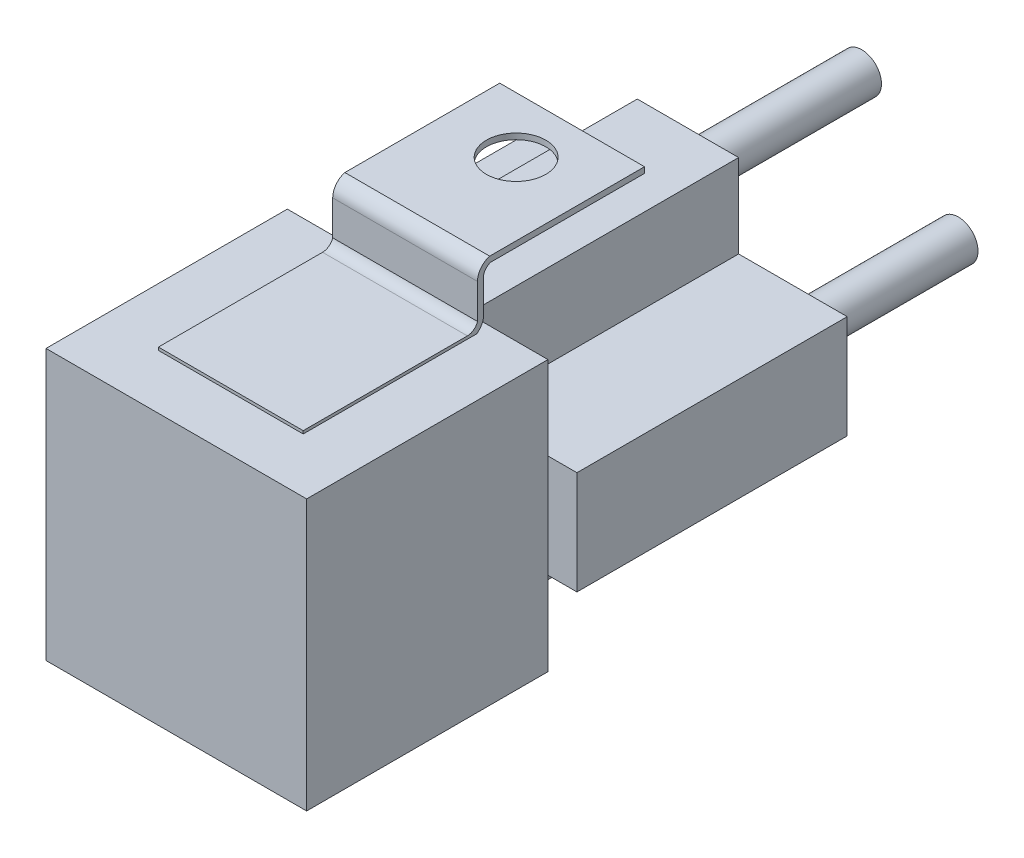
from build123d import *

# Parameters (mm, degrees)
SKETCH1_W           = 27
SKETCH1_H           = 28
BOSS_EXTRUDE1_DEPTH = 25
SKETCH2_W           = 33
SKETCH2_H           = 10.7
SKETCH2_W_2         = 10.5
SKETCH2_H_2         = 28
BOSS_EXTRUDE2_DEPTH = 28
SKETCH3_R           = 2.05
BOSS_EXTRUDE3_DEPTH = 18
EXTRUDE_THIN1_DEPTH = 7.5
MOUNTING_HOLE_REACH = 61.705
SKETCH5_R           = 3.075


with BuildPart() as part:
    # Sketch1 → Boss-Extrude1 (new body)
    with BuildSketch(Plane.XY):
        Rectangle(SKETCH1_W, SKETCH1_H)
    extrude(amount=BOSS_EXTRUDE1_DEPTH)

    # Sketch2 → Boss-Extrude2 (add)
    with BuildSketch(Plane.XY):
        Rectangle(SKETCH2_W, SKETCH2_H)
        Rectangle(SKETCH2_W_2, SKETCH2_H_2)
    extrude(amount=-BOSS_EXTRUDE2_DEPTH)

    # Sketch3 → Boss-Extrude3 (add)
    with BuildSketch(Plane(origin=(0, 0, -28), x_dir=(-1, 0, 0), z_dir=(0, 0, -1))):
        with Locations((-10, 0)):
            Circle(SKETCH3_R)
        with Locations((10, 0)):
            Circle(SKETCH3_R)
        with Locations((0, 10)):
            Circle(SKETCH3_R)
        with Locations((0, -10)):
            Circle(SKETCH3_R)
    extrude(amount=BOSS_EXTRUDE3_DEPTH)

    # Sketch4 → Extrude-Thin1 (add, symmetric)
    with BuildSketch(Plane(origin=(0, 0, 0), x_dir=(0, 0, -1), z_dir=(1, 0, 0))):
        with BuildLine():
            Line((-19.356513239, 13.7), (-2.349136171, 13.7))
            ThreePointArc((-2.349136171, 13.7), (-1.303107706, 14.059916252), (-0.7, 14.987265351))
            Line((-0.7, 14.987265351), (-0.7, 18.658359214))
            ThreePointArc((-0.7, 18.658359214), (-0.494115365, 19.29910699), (0.04646857, 19.7))
            Line((0.04646857, 19.7), (16, 19.7))
            Line((16, 19.7), (16, 20.3))
            Line((16, 20.3), (-0.041605625, 20.3))
            ThreePointArc((-0.041605625, 20.3), (-0.949208947, 19.692590918), (-1.3, 18.658359214))
            Line((-1.3, 18.658359214), (-1.3, 15.069374388))
            ThreePointArc((-1.3, 15.069374388), (-1.698631818, 14.512957675), (-2.349136171, 14.3))
            Line((-2.349136171, 14.3), (-19.356513239, 14.3))
            Line((-19.356513239, 14.3), (-19.356513239, 13.7))
        make_face()
    extrude(amount=EXTRUDE_THIN1_DEPTH, both=True)

    # Sketch5 → Mounting Hole (cut, up to next)
    with BuildSketch(Plane(origin=(0, 20.3, 0), x_dir=(1, 0, 0), z_dir=(0, 1, 0)), mode=Mode.PRIVATE) as mounting_hole_sk1:
        with Locations((0, 10.2)):
            Circle(SKETCH5_R)
    mounting_hole_tool1 = extrude(mounting_hole_sk1.sketch, amount=-MOUNTING_HOLE_REACH, mode=Mode.PRIVATE) & part.part
    add(mounting_hole_tool1.solids().sort_by_distance((0, 20.3, -10.2))[0], mode=Mode.SUBTRACT)


solid = part.part
